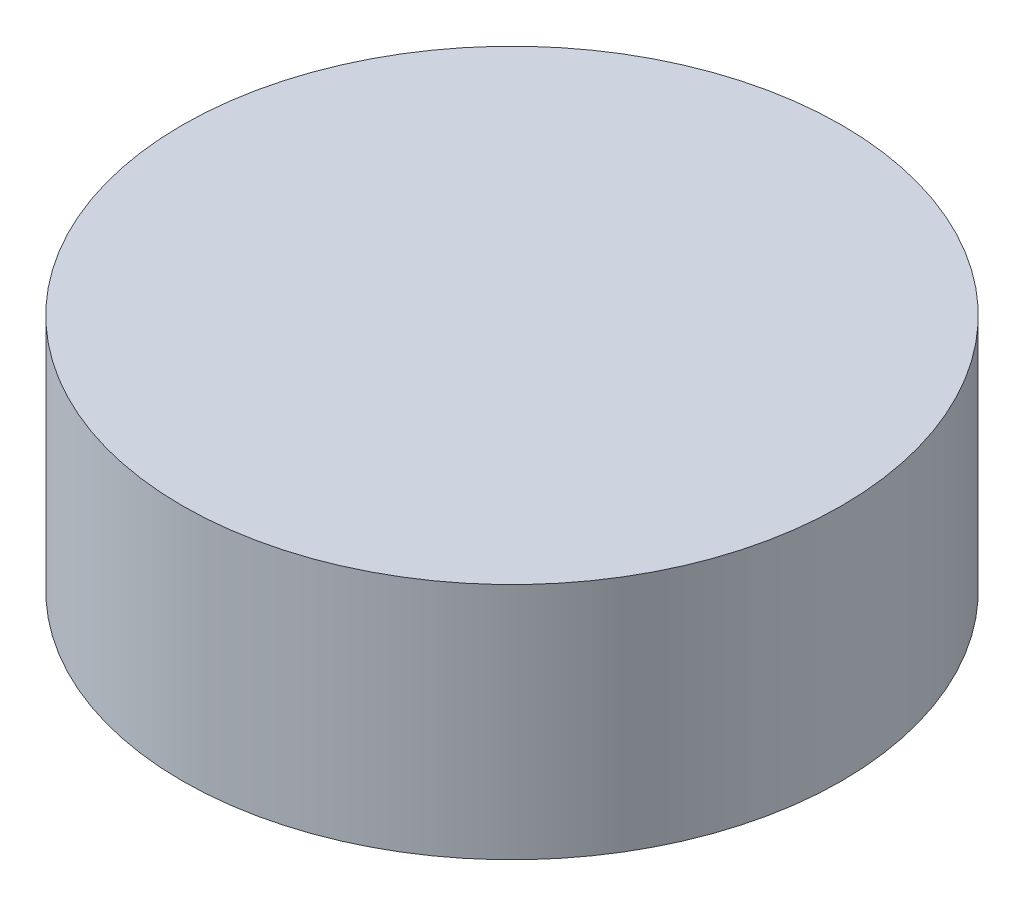
from build123d import *

# Parameters (mm, degrees)
BOSS_EXTRUDE2_DEPTH      = 2
BOSS_EXTRUDE2_DEPTH_BACK = 7
SKETCH2_R                = 12.45
SKETCH3_R                = 1.475
CUT_EXTRUDE1_DEPTH       = 6.05


with BuildPart() as part:
    # Sketch2 → Boss-Extrude2 (new, two sides: drawn at the far end of the back side and taken through both)
    with BuildSketch(Plane(origin=(0, 14, 0), x_dir=(1, 0, 0), z_dir=(0, 1, 0)).offset(-BOSS_EXTRUDE2_DEPTH_BACK)):
        with Locations((-0.498, 0)):
            Circle(SKETCH2_R)
    extrude(amount=BOSS_EXTRUDE2_DEPTH + BOSS_EXTRUDE2_DEPTH_BACK)

    # Sketch3 → Cut-Extrude1 (cut)
    with BuildSketch(Plane.XZ.offset(-7)):
        with Locations((9.5, 0)):
            Circle(SKETCH3_R)
        with Locations((4.5, -8.660254038)):
            Circle(SKETCH3_R)
        with Locations((-5.5, -8.660254038)):
            Circle(SKETCH3_R)
        with Locations((-10.5, 0)):
            Circle(SKETCH3_R)
        with Locations((-5.5, 8.660254038)):
            Circle(SKETCH3_R)
        with Locations((4.5, 8.660254038)):
            Circle(SKETCH3_R)
    extrude(amount=-CUT_EXTRUDE1_DEPTH, mode=Mode.SUBTRACT)


solid = part.part
